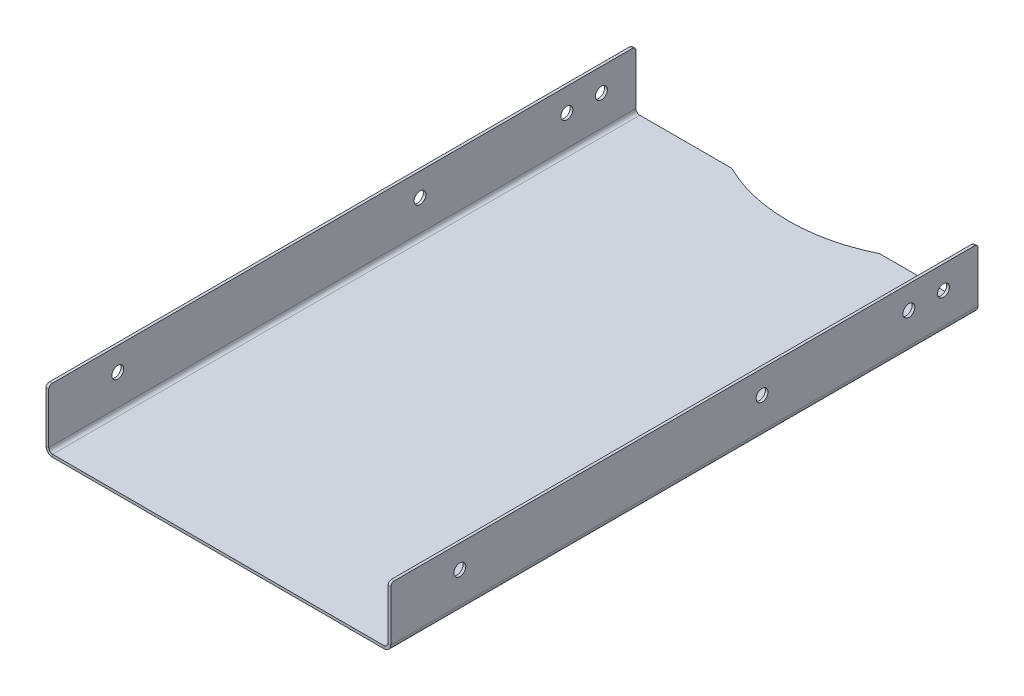
from build123d import *

# Parameters (mm, degrees)
SKETCH1_W                                 = 253.492
SKETCH1_H                                 = 457.2
BASE_FLANGE1_DEPTH                        = 1.9939
EDGE_FLANGE1_STRIP_W                      = 13.66774
EDGE_FLANGE1_STRIP_H                      = 1.9939
EDGE_FLANGE1_STRIP_CUT_DEPTH              = 457.2
EDGE_FLANGE1_STRIP_2_W                    = 13.66774
EDGE_FLANGE1_STRIP_2_H                    = 1.9939
EDGE_FLANGE1_STRIP_CUT_2_DEPTH            = 457.2
EDGE_FLANGE1_DEPTH                        = 457.2
EDGE_FLANGE1_BEND_DEPTH                   = 457.2
HOLE_FOR_1_4_SELF_CLINCHING_NUTS_S_SS_C_D = 8.7376
CUT_EXTRUDE1_DEPTH                        = 525.657828078
SKETCH16_W                                = 253.492
SKETCH16_H                                = 25.4
CUT_EXTRUDE2_DEPTH                        = 525.657828078
FILLET1_R                                 = 2.54


# Sheet-metal steps are written as plain solids
with BuildPart() as part:
    # Sketch1 → Base-Flange1 (new body)
    with BuildSketch(Plane(origin=(0, 0, 0), x_dir=(1, 0, 0), z_dir=(0, 1, 0))):
        with Locations((126.746, 228.6)):
            Rectangle(SKETCH1_W, SKETCH1_H)
    extrude(amount=-BASE_FLANGE1_DEPTH)

    # Edge-Flange1 strip (across the edge) → Edge-Flange1 strip cut (cut)
    with BuildSketch(Plane.XY.offset(-457.2)):
        with Locations((-1.9939, -0.99695)):
            Rectangle(EDGE_FLANGE1_STRIP_W, EDGE_FLANGE1_STRIP_H)
    extrude(amount=EDGE_FLANGE1_STRIP_CUT_DEPTH, mode=Mode.SUBTRACT)

    # Edge-Flange1 strip 2 (across the edge) → Edge-Flange1 strip cut 2 (cut)
    with BuildSketch(Plane(origin=(253.492, 0, 0), x_dir=(-1, 0, 0), z_dir=(0, 0, -1))):
        with Locations((-1.9939, -0.99695)):
            Rectangle(EDGE_FLANGE1_STRIP_2_W, EDGE_FLANGE1_STRIP_2_H)
    extrude(amount=EDGE_FLANGE1_STRIP_CUT_2_DEPTH, mode=Mode.SUBTRACT)

    # Edge-Flange1 section (across the edge) → Edge-Flange1 (add)
    with BuildSketch(Plane.XY.offset(-457.2)):
        with BuildLine():
            Line((0, 2.84607), (0, 42.4561))
            Line((0, 42.4561), (1.9939, 42.4561))
            Line((1.9939, 42.4561), (1.9939, 2.84607))
            ThreePointArc((1.9939, 2.84607), (2.827494603, 0.833594603), (4.83997, 0))
            Line((4.83997, 0), (4.83997, -1.9939))
            ThreePointArc((4.83997, -1.9939), (1.417594392, -0.576305608), (0, 2.84607))
        make_face()
    extrude(amount=EDGE_FLANGE1_DEPTH)

    # Edge-Flange1 section 2 (across the edge) → Edge-Flange1 bend (add)
    with BuildSketch(Plane(origin=(253.492, 0, 0), x_dir=(-1, 0, 0), z_dir=(0, 0, -1))):
        with BuildLine():
            Line((0, 2.84607), (0, 42.4561))
            Line((0, 42.4561), (1.9939, 42.4561))
            Line((1.9939, 42.4561), (1.9939, 2.84607))
            ThreePointArc((1.9939, 2.84607), (2.827494603, 0.833594603), (4.83997, 0))
            Line((4.83997, 0), (4.83997, -1.9939))
            ThreePointArc((4.83997, -1.9939), (1.417594392, -0.576305608), (0, 2.84607))
        make_face()
    extrude(amount=EDGE_FLANGE1_BEND_DEPTH)

    # Hole for 1/4 Self-clinching Nuts (S,SS,CLS,CLSS)1 (through all)
    with Locations(Plane.ZY):
        with Locations((-406.4, 25.4), (-50.8, 25.4), (-381, 25.4), (-273.05, 25.4)):
            Hole(HOLE_FOR_1_4_SELF_CLINCHING_NUTS_S_SS_C_D / 2)

    # Sketch15 → Cut-Extrude1 (cut, through all)
    with BuildSketch(Plane.XZ.offset(1.9939)):
        with BuildLine():
            Line((215.646, -457.2), (37.846, -457.2))
            ThreePointArc((37.846, -457.2), (126.746, -419.1), (215.646, -457.2))
        make_face()
    extrude(amount=-CUT_EXTRUDE1_DEPTH, mode=Mode.SUBTRACT)

    # Sketch16 → Cut-Extrude2 (cut, through all)
    with BuildSketch(Plane.XZ.offset(1.9939)):
        with Locations((126.746, -444.5)):
            Rectangle(SKETCH16_W, SKETCH16_H)
    extrude(amount=-CUT_EXTRUDE2_DEPTH, mode=Mode.SUBTRACT)

    # Fillet1
    fillet1_edges = [part.edges().sort_by_distance(p)[0] for p in [
        (0.99695, 42.4561, -431.8),
        (252.49505, 42.4561, -431.8),
        (0.99695, 42.4561, 0),
        (252.49505, 42.4561, 0),
    ]]
    fillet(fillet1_edges, radius=FILLET1_R)


solid = part.part
